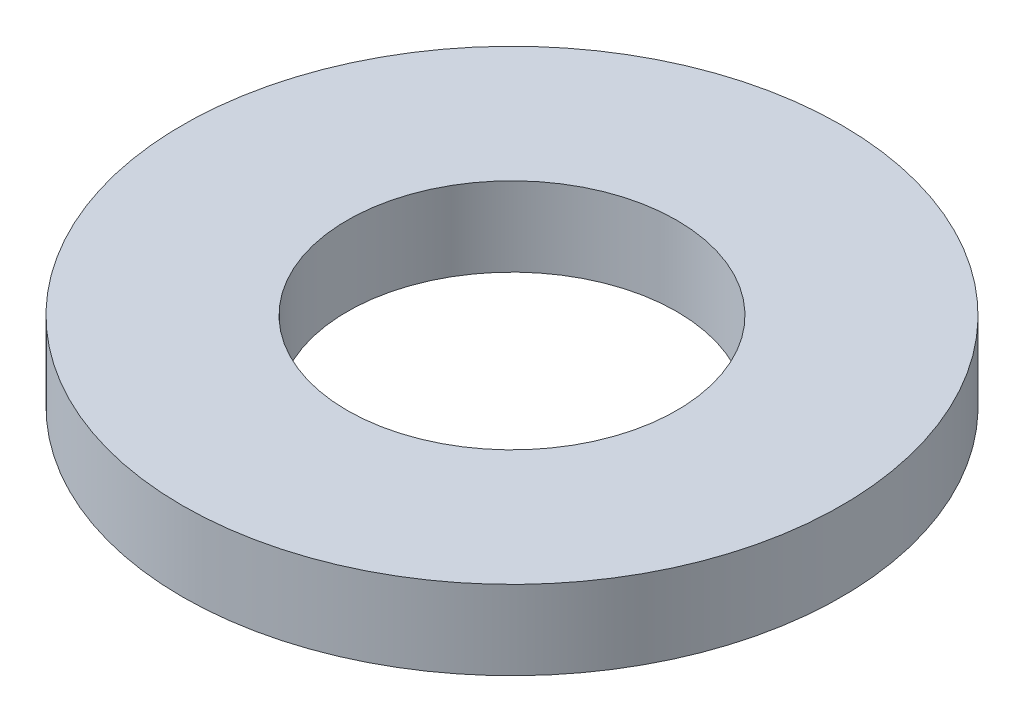
from build123d import *

# Parameters (mm, degrees)
SKETCH1_R           = 25
BOSS_EXTRUDE1_DEPTH = 6
SKETCH2_R           = 12.5
CUT_EXTRUDE1_DEPTH  = 36.860842154


with BuildPart() as part:
    # Sketch1 → Boss-Extrude1 (new body)
    with BuildSketch(Plane(origin=(0, 0, 0), x_dir=(1, 0, 0), z_dir=(0, 1, 0))):
        Circle(SKETCH1_R)
    extrude(amount=BOSS_EXTRUDE1_DEPTH)

    # Sketch2 → Cut-Extrude1 (cut, through all)
    with BuildSketch(Plane(origin=(0, 0, 0), x_dir=(1, 0, 0), z_dir=(0, 1, 0))):
        Circle(SKETCH2_R)
    extrude(amount=CUT_EXTRUDE1_DEPTH, mode=Mode.SUBTRACT)


solid = part.part
